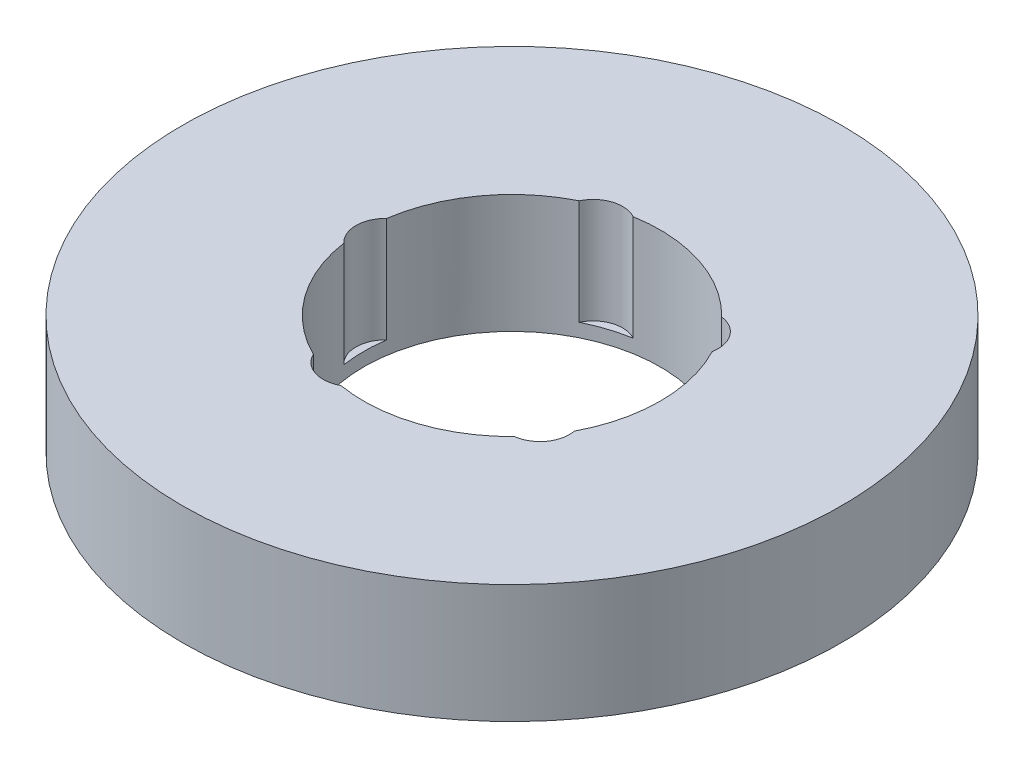
from build123d import *

# Parameters (mm, degrees)
SKETCH1_R           = 50
BOSS_EXTRUDE1_DEPTH = 18
SKETCH2_R           = 22.5
CUT_EXTRUDE1_DEPTH  = 73.965745388
SKETCH3_R           = 4.47919358
CUT_EXTRUDE2_DEPTH  = 15.961688016
CIRPATTERN1_COUNT   = 5


with BuildPart() as part:
    # Sketch1 → Boss-Extrude1 (new body)
    with BuildSketch(Plane(origin=(0, 0, 0), x_dir=(1, 0, 0), z_dir=(0, 1, 0))):
        Circle(SKETCH1_R)
    extrude(amount=BOSS_EXTRUDE1_DEPTH)

    # Sketch2 → Cut-Extrude1 (cut, through all)
    with BuildSketch(Plane(origin=(0, 0, 0), x_dir=(1, 0, 0), z_dir=(0, 1, 0))):
        Circle(SKETCH2_R)
    extrude(amount=CUT_EXTRUDE1_DEPTH, mode=Mode.SUBTRACT)

    # Sketch3 → Cut-Extrude2 (cut)
    with BuildSketch(Plane(origin=(0, 18, 0), x_dir=(1, 0, 0), z_dir=(0, 1, 0))):
        with Locations((-19.185270502, 0)):
            Circle(SKETCH3_R)
    cut_extrude2 = extrude(amount=-CUT_EXTRUDE2_DEPTH, mode=Mode.SUBTRACT)

    # CirPattern1: Cut-Extrude2 ×5 about axis
    cirpattern1_axis = Axis((0, 0, 0), (0, 1, 0))
    for i in range(1, CIRPATTERN1_COUNT):
        add(cut_extrude2.rotate(cirpattern1_axis, i * 360 / CIRPATTERN1_COUNT), mode=Mode.SUBTRACT)


solid = part.part
